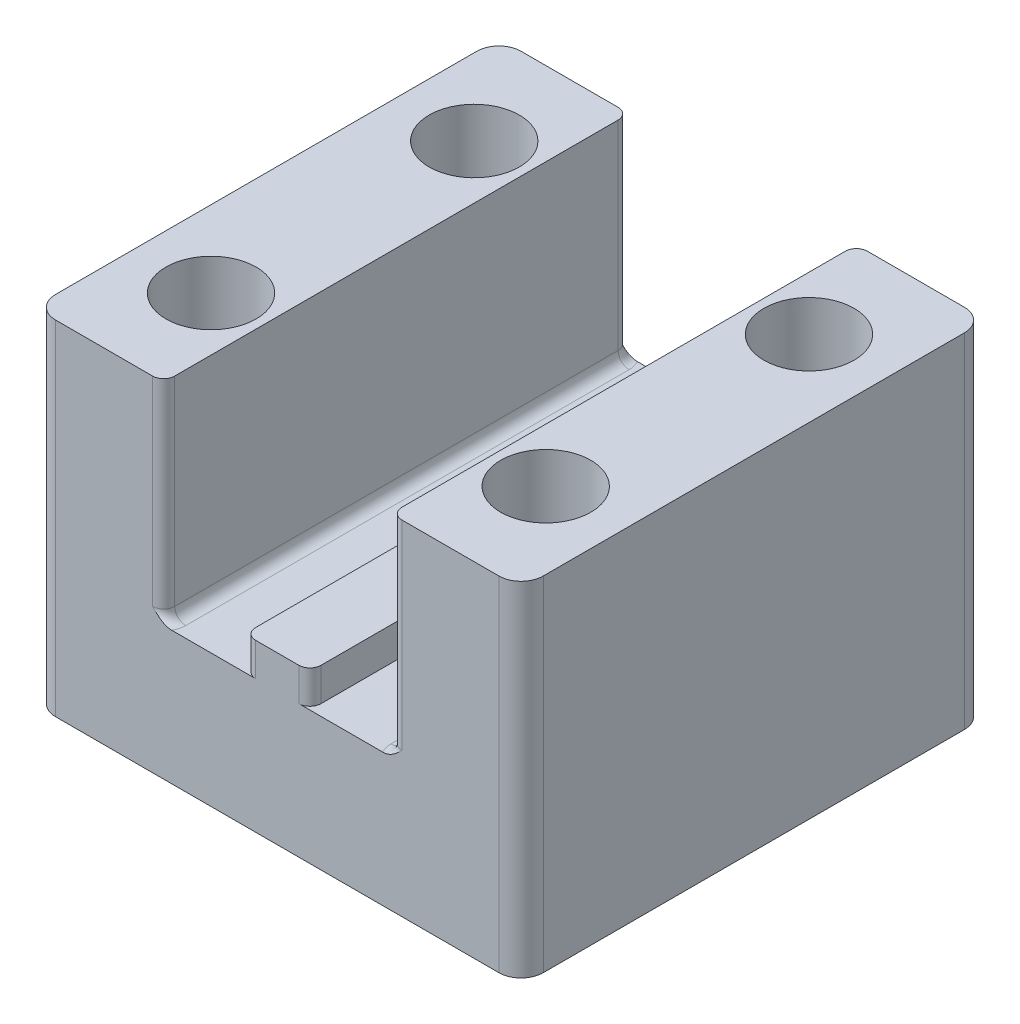
from build123d import *

# Parameters (mm, degrees)
ESQUISSE1_W             = 44
ESQUISSE1_H             = 42
ESQUISSE1_R             = 4.065
BOSS_EXTRU_1_DEPTH      = 12
ESQUISSE2_W             = 5.9
ESQUISSE2_H             = 42
ESQUISSE2_W_2           = 11.75
ESQUISSE2_R             = 4.065
BOSS_EXTRU_2_DEPTH      = 19
ESQUISSE3_W             = 5.9
ESQUISSE3_H             = 42
ENL_V_MAT_EXTRU_1_DEPTH = 16
CONG_1_R                = 2
CONG_2_R                = 1
CONG_3_R                = 1


with BuildPart() as part:
    # Esquisse1 → Boss.-Extru.1 (new body)
    with BuildSketch(Plane(origin=(0, 0, 0), x_dir=(1, 0, 0), z_dir=(0, 1, 0))):
        Rectangle(ESQUISSE1_W, ESQUISSE1_H)
        with Locations(Location((-15.1, 11.875, 0), (0, 0, 270))):
            Circle(ESQUISSE1_R, mode=Mode.SUBTRACT)
        with Locations(Location((15.1, 11.875, 0), (0, 0, 90))):
            Circle(ESQUISSE1_R, mode=Mode.SUBTRACT)
        with Locations(Location((15.1, -11.875, 0), (0, 0, 270))):
            Circle(ESQUISSE1_R, mode=Mode.SUBTRACT)
        with Locations(Location((-15.1, -11.875, 0), (0, 0, 90))):
            Circle(ESQUISSE1_R, mode=Mode.SUBTRACT)
    extrude(amount=BOSS_EXTRU_1_DEPTH)

    # Esquisse2 → Boss.-Extru.2 (add)
    # profile 1 of 3: a face of its own
    with BuildSketch(Plane(origin=(0, 12, 0), x_dir=(1, 0, 0), z_dir=(0, 1, 0))):
        Rectangle(ESQUISSE2_W, ESQUISSE2_H)
    # profile 2 of 3: a face of its own
    with BuildSketch(Plane(origin=(0, 12, 0), x_dir=(1, 0, 0), z_dir=(0, 1, 0))):
        with Locations((-16.125, 0)):
            Rectangle(ESQUISSE2_W_2, ESQUISSE2_H)
        with Locations(Location((-15.1, -11.875, 0), (0, 0, 90))):
            Circle(ESQUISSE2_R, mode=Mode.SUBTRACT)
        with Locations(Location((-15.1, 11.875, 0), (0, 0, 270))):
            Circle(ESQUISSE2_R, mode=Mode.SUBTRACT)
    # profile 3 of 3: a face of its own
    with BuildSketch(Plane(origin=(0, 12, 0), x_dir=(1, 0, 0), z_dir=(0, 1, 0))):
        with Locations((16.125, 0)):
            Rectangle(ESQUISSE2_W_2, ESQUISSE2_H)
        with Locations(Location((15.1, 11.875, 0), (0, 0, 90))):
            Circle(ESQUISSE2_R, mode=Mode.SUBTRACT)
        with Locations(Location((15.1, -11.875, 0), (0, 0, 270))):
            Circle(ESQUISSE2_R, mode=Mode.SUBTRACT)
    extrude(amount=BOSS_EXTRU_2_DEPTH)

    # Esquisse3 → Enlèv. mat.-Extru.1 (cut)
    with BuildSketch(Plane(origin=(0, 31, 0), x_dir=(1, 0, 0), z_dir=(0, 1, 0))):
        Rectangle(ESQUISSE3_W, ESQUISSE3_H)
    extrude(amount=-ENL_V_MAT_EXTRU_1_DEPTH, mode=Mode.SUBTRACT)

    # Congé1
    cong_1_edges = [part.edges().sort_by_distance(p)[0] for p in [
        (-22, 15.5, -21),
        (22, 15.5, -21),
        (22, 15.5, 21),
        (-22, 15.5, 21),
    ]]
    fillet(cong_1_edges, radius=CONG_1_R)

    # Congé2
    cong_2_edges = [part.edges().sort_by_distance(p)[0] for p in [
        (-10.25, 21.5, 21),
        (-10.25, 21.5, -21),
        (10.25, 21.5, -21),
        (10.25, 21.5, 21),
        (-2.95, 13.5, 21),
        (-2.95, 13.5, -21),
        (2.95, 13.5, -21),
        (2.95, 13.5, 21),
    ]]
    fillet(cong_2_edges, radius=CONG_2_R)

    # Congé3
    # the kernel refuses this fillet: 1 mm, written as the material it adds along each edge
    with BuildSketch(Plane(origin=(10.25, 12, -20), x_dir=(0, 1, 0), z_dir=(0, 0, 1))) as cong_3_piece_1:
        with BuildLine():
            CenterArc((CONG_3_R, CONG_3_R), CONG_3_R, 180, 90)
            Line((0, CONG_3_R), (0, 0))
            Line((0, 0), (CONG_3_R, 0))
        make_face()
    extrude(amount=40)
    with BuildSketch(Plane(origin=(-10.25, 12, -20), x_dir=(0, 1, 0), z_dir=(0, 0, 1))) as cong_3_piece_2:
        with BuildLine():
            CenterArc((CONG_3_R, -CONG_3_R), CONG_3_R, 90, 90)
            Line((0, -CONG_3_R), (0, 0))
            Line((0, 0), (CONG_3_R, 0))
        make_face()
    extrude(amount=40)
    with BuildSketch(Plane(origin=(11.25, 12, -20), x_dir=(0.5976672776328271, 0, 0.8017442392976486), z_dir=(-0.8017442392976486, 0, 0.5976672776328271))) as cong_3_piece_3_section:
        with BuildLine():
            CenterArc((1 + CONG_3_R, CONG_3_R), CONG_3_R, 180, 90)
            Line((1, CONG_3_R), (1, 0))
            Line((1, 0), (1 + CONG_3_R, 0))
        make_face()
    cong_3_piece_3 = revolve(axis=Axis((11.25, 12, -20), (0, 1, 0)), revolution_arc=233.296989237, mode=Mode.PRIVATE)
    cong_3_piece_3 = split(cong_3_piece_3, bisect_by=Plane(origin=(10.500061043, 12.311628317, -21), z_dir=(0, 0, 1)), keep=Keep.TOP, mode=Mode.PRIVATE)
    add(cong_3_piece_3)
    with BuildSketch(Plane(origin=(11.25, 12, 20), x_dir=(-1, 0, 0), z_dir=(0, 0, -1))) as cong_3_piece_4_section:
        with BuildLine():
            CenterArc((1 + CONG_3_R, CONG_3_R), CONG_3_R, 180, 90)
            Line((1 + CONG_3_R, 0), (1, 0))
            Line((1, 0), (1, CONG_3_R))
        make_face()
    cong_3_piece_4 = revolve(axis=Axis((11.25, 12, 20), (0, 1, 0)), revolution_arc=233.296989237, mode=Mode.PRIVATE)
    cong_3_piece_4 = split(cong_3_piece_4, bisect_by=Plane(origin=(10.500061142, 12.311628426, 21), z_dir=(0, 0, -1)), keep=Keep.TOP, mode=Mode.PRIVATE)
    add(cong_3_piece_4)
    with BuildSketch(Plane(origin=(-11.25, 12, -20), x_dir=(-0.5976672776328282, 0, 0.8017442392976477), z_dir=(0.8017442392976477, 0, 0.5976672776328282))) as cong_3_piece_5_section:
        with BuildLine():
            CenterArc((1 + CONG_3_R, -CONG_3_R), CONG_3_R, 90, 90)
            Line((1 + CONG_3_R, 0), (1, 0))
            Line((1, 0), (1, -CONG_3_R))
        make_face()
    cong_3_piece_5 = revolve(axis=Axis((-11.25, 12, -20), (0, -1, 0)), revolution_arc=233.296989237, mode=Mode.PRIVATE)
    cong_3_piece_5 = split(cong_3_piece_5, bisect_by=Plane(origin=(-10.500061216, 12.311628717, -21), z_dir=(0, 0, 1)), keep=Keep.TOP, mode=Mode.PRIVATE)
    add(cong_3_piece_5)
    with BuildSketch(Plane(origin=(-11.25, 12, 20), x_dir=(1, 0, 0), z_dir=(0, 0, -1))) as cong_3_piece_6_section:
        with BuildLine():
            CenterArc((1 + CONG_3_R, -CONG_3_R), CONG_3_R, 90, 90)
            Line((1 + CONG_3_R, 0), (1, 0))
            Line((1, 0), (1, -CONG_3_R))
        make_face()
    cong_3_piece_6 = revolve(axis=Axis((-11.25, 12, 20), (0, -1, 0)), revolution_arc=233.296989237, mode=Mode.PRIVATE)
    cong_3_piece_6 = split(cong_3_piece_6, bisect_by=Plane(origin=(-10.500060984, 12.311628017, 21), z_dir=(0, 0, -1)), keep=Keep.TOP, mode=Mode.PRIVATE)
    add(cong_3_piece_6)


solid = part.part
